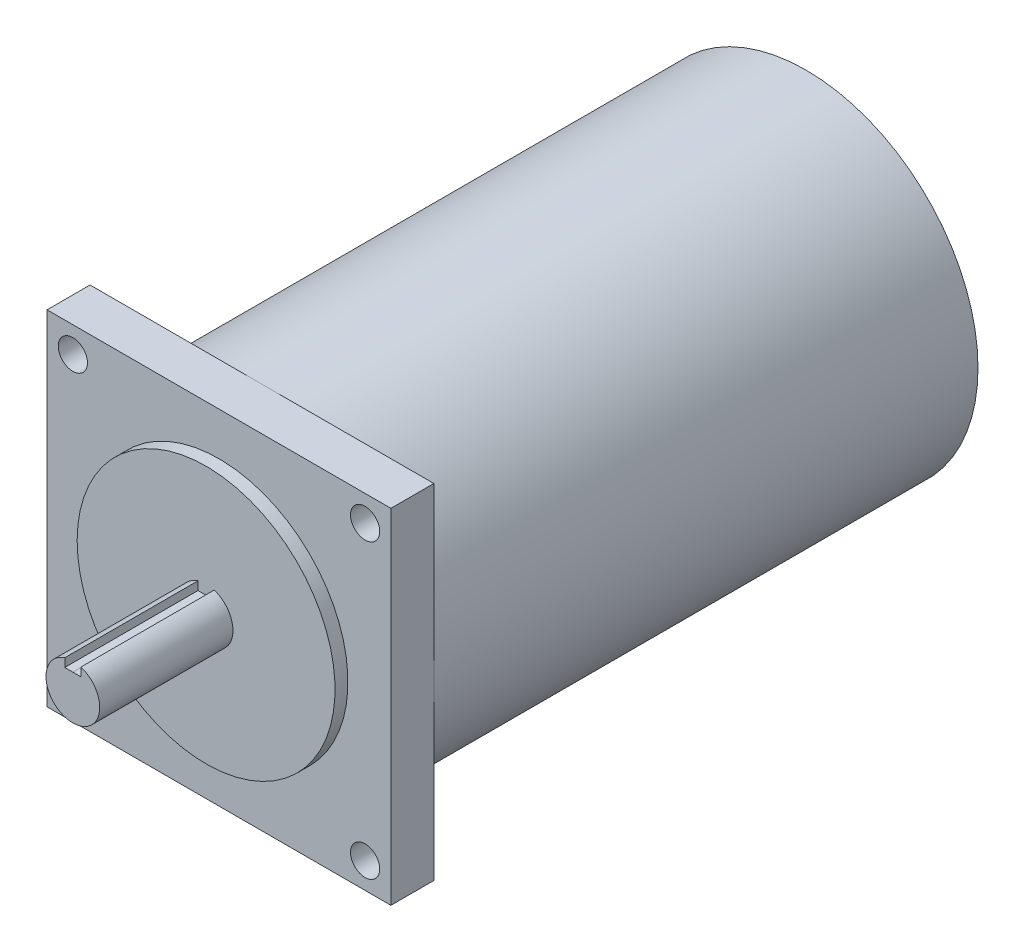
from build123d import *

# Parameters (mm, degrees)
SKETCH1_W               = 101.6
SKETCH1_H               = 101.6
SKETCH1_R               = 4.318
BOSS_EXTRUDE1_DEPTH     = 12.7
SKETCH2_R               = 38.1
BOSS_EXTRUDE2_DEPTH     = 3.81
SKETCH4_R               = 7.9375
BOSS_EXTRUDE4_DEPTH     = 39.37
CUT_EXTRUDE1_DEPTH      = 92.015682165
CUT_EXTRUDE1_DEPTH_BACK = 39.37
SKETCH6_R               = 50.8
BOSS_EXTRUDE5_DEPTH     = 160.782
BOSS_EXTRUDE6_START     = 3.81
SKETCH7_R               = 38.1
BOSS_EXTRUDE6_DEPTH     = 3.81
SKETCH8_R               = 6.35
BOSS_EXTRUDE7_DEPTH     = 17.78


with BuildPart() as part:
    # Sketch1 → Boss-Extrude1 (new body)
    with BuildSketch(Plane.XY):
        Rectangle(SKETCH1_W, SKETCH1_H)
        with Locations((-43.18, -43.18)):
            Circle(SKETCH1_R, mode=Mode.SUBTRACT)
        with Locations((43.18, -43.18)):
            Circle(SKETCH1_R, mode=Mode.SUBTRACT)
        with Locations((43.18, 43.18)):
            Circle(SKETCH1_R, mode=Mode.SUBTRACT)
        with Locations((-43.18, 43.18)):
            Circle(SKETCH1_R, mode=Mode.SUBTRACT)
    extrude(amount=BOSS_EXTRUDE1_DEPTH)

    # Sketch2 → Boss-Extrude2 (add)
    with BuildSketch(Plane.XY.offset(12.7)):
        Circle(SKETCH2_R)
    extrude(amount=BOSS_EXTRUDE2_DEPTH)

    # Sketch4 → Boss-Extrude4 (add)
    with BuildSketch(Plane.XY.offset(16.51)):
        Circle(SKETCH4_R)
    extrude(amount=BOSS_EXTRUDE4_DEPTH)

    # Sketch5 → Cut-Extrude1 (cut, two sides: drawn at the far end of the back side and taken through both)
    with BuildSketch(Plane.XY.offset(55.88).offset(-CUT_EXTRUDE1_DEPTH_BACK)):
        Polygon((2.3876, 175.506147294), (2.3876, 7.569892502), (2.3876, 5.06380496), (0, 5.06380496), (-2.3876, 5.06380496), (-2.3876, 7.569892502), (-2.3876, 175.506147294), (-2.3876, 511.378656878), (2.3876, 511.378656878), align=None)
    extrude(amount=CUT_EXTRUDE1_DEPTH + CUT_EXTRUDE1_DEPTH_BACK, mode=Mode.SUBTRACT)

    # Sketch6 → Boss-Extrude5 (add)
    with BuildSketch(Plane(origin=(0, 0, 0), x_dir=(-1, 0, 0), z_dir=(0, 0, -1))):
        Circle(SKETCH6_R)
    extrude(amount=BOSS_EXTRUDE5_DEPTH)

    # Sketch7 → Boss-Extrude6 (add)
    with BuildSketch(Plane(origin=(0, 0, -160.782), x_dir=(-1, 0, 0), z_dir=(0, 0, -1)).offset(BOSS_EXTRUDE6_START)):
        Circle(SKETCH7_R)
    extrude(amount=-BOSS_EXTRUDE6_DEPTH)

    # Sketch8 → Boss-Extrude7 (add)
    with BuildSketch(Plane(origin=(0, 0, -164.592), x_dir=(-1, 0, 0), z_dir=(0, 0, -1))):
        Circle(SKETCH8_R)
    extrude(amount=BOSS_EXTRUDE7_DEPTH)


solid = part.part
